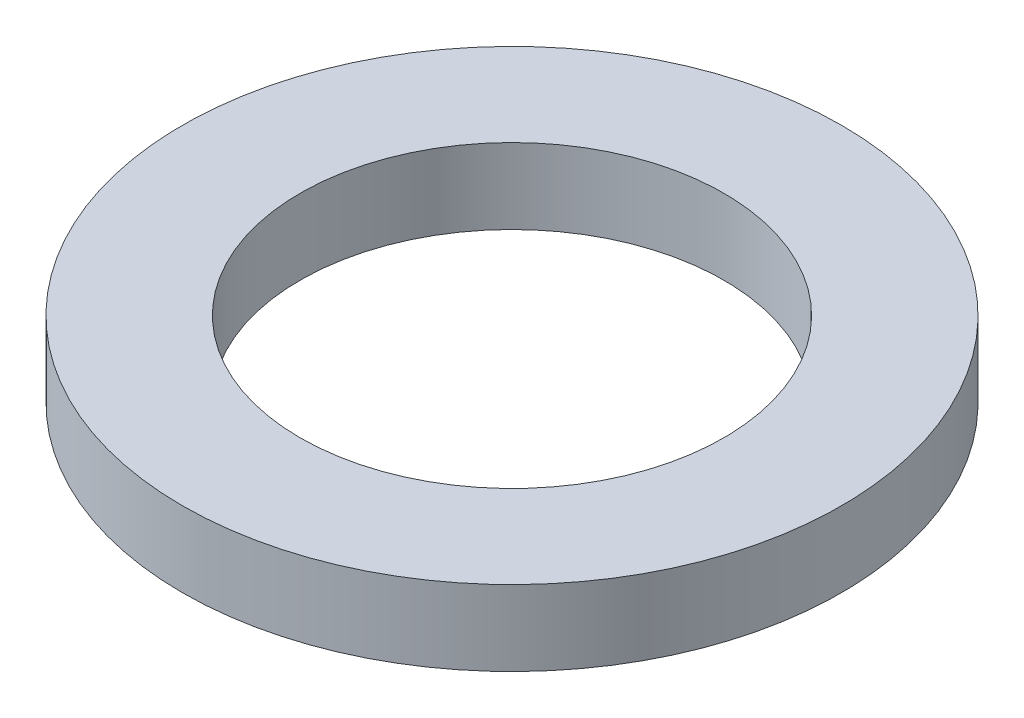
from build123d import *

# Parameters (mm, degrees)
BODYSKE_W = 2.5
BODYSKE_H = 1.6


with BuildPart() as part:
    # BodySke → BaseBody (revolve)
    with BuildSketch(Plane(origin=(0, 0, 0), x_dir=(1, 0, 0), z_dir=(0, 0, -1))):
        with Locations((5.75, 0.8)):
            Rectangle(BODYSKE_W, BODYSKE_H)
    revolve(axis=Axis((0, 0, 0), (0, -1, 0)))


solid = part.part
